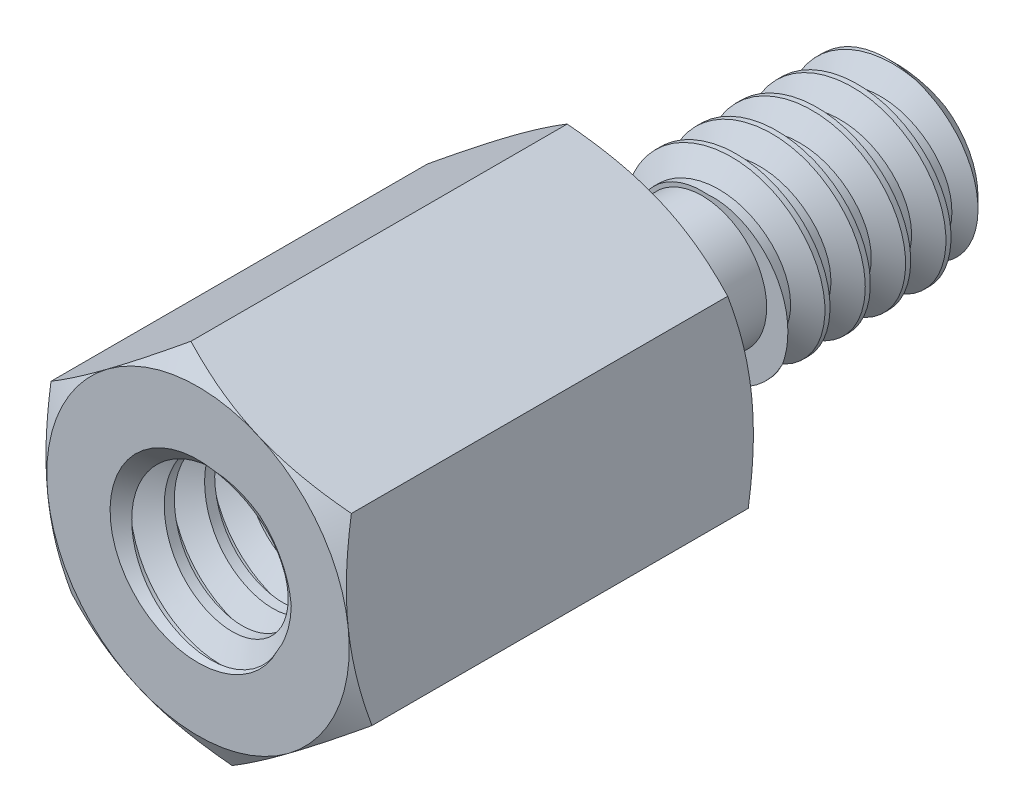
from build123d import *

# Parameters (mm, degrees)
BOSS_EXTRUDE1_DEPTH           = 6.35
SKETCH2_OUTSIDE_W             = 16.93
SKETCH2_OUTSIDE_H             = 17.336
SKETCH2_OUTSIDE_R             = 2.38125
CUT_EXTRUDE1_DEPTH            = 2.286
CUT_EXTRUDE1_DRAFT            = -60
SKETCH3_OUTSIDE_W             = 16.93
SKETCH3_OUTSIDE_H             = 17.336
SKETCH3_OUTSIDE_R             = 2.38125
CUT_EXTRUDE2_DEPTH            = 2.286
CUT_EXTRUDE2_DRAFT            = -60
TAP_DRILL_FOR_4_40_TAP1_D     = 2.2606
TAP_DRILL_FOR_4_40_TAP1_DEPTH = 5.08
TAP_DRILL_FOR_4_40_TAP1_TIP   = 0.679152758
CHAMFER2_SIZE                 = 0.254
THREAD1_PITCH                 = 0.635
SKETCH11_R                    = 1.016
BOSS_EXTRUDE2_DEPTH           = 1.5875
SKETCH12_R                    = 1.4224
BOSS_EXTRUDE3_DEPTH           = 3.175
CHAMFER1_SIZE                 = 0.254
THREAD2_PITCH                 = 0.635


with BuildPart() as part:
    # Sketch1 → Boss-Extrude1 (new body)
    with BuildSketch(Plane.XY):
        Polygon((2.202426177, 1.646143276), (-0.324388807, 2.730428657), (-2.526814984, 1.084285381), (-2.202426177, -1.646143276), (0.324388807, -2.730428657), (2.526814984, -1.084285381), align=None)
    extrude(amount=BOSS_EXTRUDE1_DEPTH)


with BuildPart() as cut_extrude1_tool:
    # Sketch2 outside → Cut-Extrude1 (with draft: the straight prism first)
    with BuildSketch(Plane.XY.offset(6.35)):
        Rectangle(SKETCH2_OUTSIDE_W, SKETCH2_OUTSIDE_H)
        Circle(SKETCH2_OUTSIDE_R, mode=Mode.SUBTRACT)
    extrude(amount=-CUT_EXTRUDE1_DEPTH)
    # Cut-Extrude1: the draft: its side faces are tilted about the plane it starts from
    cut_extrude1_sides = [cut_extrude1_tool.faces().sort_by_distance(p)[0] for p in [
        (0, -8.668, 5.207),
        (8.465, 0, 5.207),
        (0, 8.668, 5.207),
        (-8.465, 0, 5.207),
        (-2.38125, 0, 5.207),
    ]]
    draft(cut_extrude1_sides, Plane.XY.offset(6.35), CUT_EXTRUDE1_DRAFT)


with BuildPart() as part_1:
    add(part.part)

    # Cut-Extrude1: cut by cut_extrude1_tool
    add(cut_extrude1_tool.part, mode=Mode.SUBTRACT)


with BuildPart() as cut_extrude2_tool:
    # Sketch3 outside → Cut-Extrude2 (with draft: the straight prism first)
    with BuildSketch(Plane(origin=(0, 0, 0), x_dir=(-1, 0, 0), z_dir=(0, 0, -1))):
        Rectangle(SKETCH3_OUTSIDE_W, SKETCH3_OUTSIDE_H)
        Circle(SKETCH3_OUTSIDE_R, mode=Mode.SUBTRACT)
    extrude(amount=-CUT_EXTRUDE2_DEPTH)
    # Cut-Extrude2: the draft: its side faces are tilted about the plane it starts from
    cut_extrude2_sides = [cut_extrude2_tool.faces().sort_by_distance(p)[0] for p in [
        (0, -8.668, 1.143),
        (-8.465, 0, 1.143),
        (0, 8.668, 1.143),
        (8.465, 0, 1.143),
        (2.38125, 0, 1.143),
    ]]
    draft(cut_extrude2_sides, Plane(origin=(0, 0, 0), x_dir=(-1, 0, 0), z_dir=(0, 0, -1)), CUT_EXTRUDE2_DRAFT)


with BuildPart() as part_2:
    add(part_1.part)

    # Cut-Extrude2: cut by cut_extrude2_tool
    add(cut_extrude2_tool.part, mode=Mode.SUBTRACT)

    # Tap Drill for #4-40 Tap1
    with Locations(Plane.XY.offset(6.35)):
        with Locations((0, 0)):
            Hole(TAP_DRILL_FOR_4_40_TAP1_D / 2, depth=TAP_DRILL_FOR_4_40_TAP1_DEPTH)
            with Locations((0, 0, -(TAP_DRILL_FOR_4_40_TAP1_DEPTH + TAP_DRILL_FOR_4_40_TAP1_TIP / 2))):  # 118° drill point
                Cone(0, TAP_DRILL_FOR_4_40_TAP1_D / 2, TAP_DRILL_FOR_4_40_TAP1_TIP, mode=Mode.SUBTRACT)

    # Chamfer2
    chamfer2_edges = [part_2.edges().sort_by_distance(p)[0] for p in [
        (1.1303, 0, 6.35),
    ]]
    chamfer(chamfer2_edges, length=CHAMFER2_SIZE)

    # Thread1: arcs per turn and ends read off the stored shape
    # Thread1: the profile of Thread Profile1 profile screwed along a right-hand helix through 10 turns, 6 arcs to a turn; built about Z, then put on its axis
    thread1_z = Axis((0, 0, 0), (0, 0, 1))
    thread1_corners = [(1.13, 0, -0.000173205), (1.474003831, 0, 0.198437499), (1.474003831, 0, 0.277812499), (1.13, 0, 0.476423203)]
    with BuildLine(mode=Mode.PRIVATE) as thread1_profile:
        Line(thread1_corners[0], thread1_corners[1])
        Line(thread1_corners[1], thread1_corners[2])
        Line(thread1_corners[2], thread1_corners[3])
        Line(thread1_corners[3], thread1_corners[0])
    thread1_cap = Face(thread1_profile.wire())
    thread1_turn_angles = [0, 30, 60, 90, 120, 150, 180, 210, 240, 270, 300, 330, 360]
    thread1_turn_weights = [1, 0.8660254037844387, 1, 0.8660254037844387, 1, 0.8660254037844387, 1, 0.8660254037844387, 1, 0.8660254037844387, 1, 0.8660254037844387, 1]
    thread1_turn_rails = [Edge.make_bspline([Vector(p[0], p[1], 0).rotate(thread1_z, thread1_turn_angles[k]) / thread1_turn_weights[k] + Vector(0, 0, p[2] + THREAD1_PITCH * thread1_turn_angles[k] / 360) for k in range(13)], [0, 0, 0, 1, 1, 2, 2, 3, 3, 4, 4, 5, 5, 6, 6, 6], 2, thread1_turn_weights) for p in thread1_corners]
    thread1_turn_sides = [Face.make_surface_from_curves(thread1_turn_rails[p[0]], thread1_turn_rails[p[1]]) for p in [(0, 1), (1, 2), (2, 3), (3, 0)]]
    thread1 = Plane(origin=(0, 0, 6.858), x_dir=(-1, 0, 0), z_dir=(0, 0, -1)) * Solid(Shell([*[p.moved(Location((0, 0, THREAD1_PITCH * i))) for i in range(10) for p in thread1_turn_sides], thread1_cap, thread1_cap.rotate(thread1_z, 3600).moved(Location((0, 0, THREAD1_PITCH * 3600 / 360)))]))
    add(thread1, mode=Mode.SUBTRACT)

    # Sketch11 → Boss-Extrude2 (add)
    with BuildSketch(Plane(origin=(0, 0, 0), x_dir=(-1, 0, 0), z_dir=(0, 0, -1))):
        with Locations(Location((0, 0, 0), (0, 0, 180))):
            Circle(SKETCH11_R)
    extrude(amount=BOSS_EXTRUDE2_DEPTH)

    # Sketch12 → Boss-Extrude3 (add)
    with BuildSketch(Plane(origin=(0, 0, -1.5875), x_dir=(-1, 0, 0), z_dir=(0, 0, -1))):
        Circle(SKETCH12_R)
    extrude(amount=BOSS_EXTRUDE3_DEPTH)

    # Chamfer1
    chamfer1_edges = [part_2.edges().sort_by_distance(p)[0] for p in [
        (1.4224, 0, -4.7625),
    ]]
    chamfer(chamfer1_edges, length=CHAMFER1_SIZE)

    # Thread2: arcs per turn and ends read off the stored shape
    # Thread2: the profile of Thread Profile2 profile screwed along a right-hand helix through 6.599997 turns, 6 arcs to a turn; built about Z, then put on its axis
    thread2_z = Axis((0, 0, 0), (0, 0, 1))
    thread2_corners = [(1.4227, 0, -0.000173205), (1.4227, 0, 0.555798203), (1.078696169, 0, 0.357187499), (1.078696169, 0, 0.198437499)]
    with BuildLine(mode=Mode.PRIVATE) as thread2_profile:
        Line(thread2_corners[0], thread2_corners[1])
        Line(thread2_corners[1], thread2_corners[2])
        Line(thread2_corners[2], thread2_corners[3])
        Line(thread2_corners[3], thread2_corners[0])
    thread2_cap = Face(thread2_profile.wire())
    thread2_turn_angles = [0, 30, 60, 90, 120, 150, 180, 210, 240, 270, 300, 330, 360]
    thread2_turn_weights = [1, 0.8660254037844387, 1, 0.8660254037844387, 1, 0.8660254037844387, 1, 0.8660254037844387, 1, 0.8660254037844387, 1, 0.8660254037844387, 1]
    thread2_turn_rails = [Edge.make_bspline([Vector(p[0], p[1], 0).rotate(thread2_z, thread2_turn_angles[k]) / thread2_turn_weights[k] + Vector(0, 0, p[2] + THREAD2_PITCH * thread2_turn_angles[k] / 360) for k in range(13)], [0, 0, 0, 1, 1, 2, 2, 3, 3, 4, 4, 5, 5, 6, 6, 6], 2, thread2_turn_weights) for p in thread2_corners]
    thread2_turn_sides = [Face.make_surface_from_curves(thread2_turn_rails[p[0]], thread2_turn_rails[p[1]]) for p in [(0, 1), (1, 2), (2, 3), (3, 0)]]
    thread2_last_angles = [2160, 2190, 2220, 2250, 2280, 2310, 2340, 2357.9995, 2375.999]
    thread2_last_weights = [1, 0.8660254037844387, 1, 0.8660254037844387, 1, 0.8660254037844387, 1, 0.9510592129409388, 1]
    thread2_last_rails = [Edge.make_bspline([Vector(p[0], p[1], 0).rotate(thread2_z, thread2_last_angles[k]) / thread2_last_weights[k] + Vector(0, 0, p[2] + THREAD2_PITCH * thread2_last_angles[k] / 360) for k in range(9)], [0, 0, 0, 1, 1, 2, 2, 3, 3, 4, 4, 4], 2, thread2_last_weights) for p in thread2_corners]
    thread2_last_sides = [Face.make_surface_from_curves(thread2_last_rails[p[0]], thread2_last_rails[p[1]]) for p in [(0, 1), (1, 2), (2, 3), (3, 0)]]
    thread2 = Plane(origin=(0, 0, -5.2705), x_dir=(1, 0, 0), z_dir=(0, 0, 1)) * Solid(Shell([*[p.moved(Location((0, 0, THREAD2_PITCH * i))) for i in range(6) for p in thread2_turn_sides], *thread2_last_sides, thread2_cap, thread2_cap.rotate(thread2_z, 2375.999).moved(Location((0, 0, THREAD2_PITCH * 2375.999 / 360)))]))
    add(thread2, mode=Mode.SUBTRACT)


solid = part_2.part
